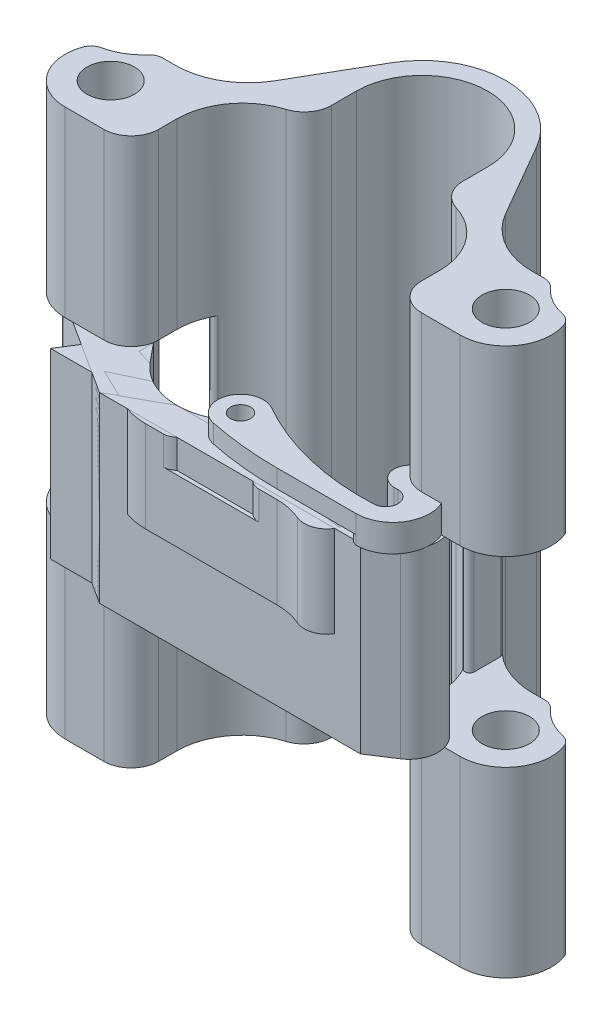
from build123d import *

# Parameters (mm, degrees)
SKETCH19_R              = 3.302
SKETCH19_R_2            = 1.5875
BOSS_EXTRUDE4_DEPTH     = 12.7
CUT_EXTRUDE2_START      = 12.7
CUT_EXTRUDE2_DEPTH      = 4
BOSS_EXTRUDE5_START     = 13.97
SKETCH20_R              = 1.4
BOSS_EXTRUDE5_DEPTH     = 2.54
BOSS_EXTRUDE6_REACH     = 49.508
FILLET3_R               = 1.905
SKETCH9_R               = 3.302
BOSS_EXTRUDE1_DEPTH     = 76.2
FILLET2_R               = 1.905
CUT_EXTRUDE1_DEPTH      = 95.251173486
CUT_EXTRUDE1_DEPTH_BACK = 95.251173486
SKETCH11_W              = 23.485343907
SKETCH11_H              = 25.4
FILLET1_START           = 31.75
FILLET1_DEPTH           = 25.4
SKETCH16_R              = 3.302
BOSS_EXTRUDE2_DEPTH     = 25.4
BOSS_EXTRUDE3_DEPTH     = 25.4


with BuildPart() as part:
    # Sketch19 → Boss-Extrude4 (new body)
    with BuildSketch(Plane(origin=(0, 44.45, 0), x_dir=(1, 0, 0), z_dir=(0, 1, 0))):
        with BuildLine():
            Line((-29.706388395, -20.449050539), (-13.016758738, -28.513116917))
            ThreePointArc((-13.016758738, -28.513116917), (-11.130472315, -29.175223594), (-9.144, -29.399699566))
            Line((-9.144, -29.399699566), (9.144, -29.399699566))
            ThreePointArc((9.144, -29.399699566), (10.971992807, -29.584281153), (12.726185567, -30.130573954))
            ThreePointArc((12.726185567, -30.130573954), (17.145, -27.209349783), (12.726185567, -24.288125612))
            ThreePointArc((12.726185567, -24.288125612), (6.281816233, -24.559505748), (1.261595802, -20.509699566))
            Line((1.261595802, -20.509699566), (-1.261595802, -20.509699566))
            ThreePointArc((-1.261595802, -20.509699566), (-8.447611674, -24.992443682), (-16.231079518, -21.653065412))
            Line((-16.231079518, -21.653065412), (-23.559040171, -12.66496366))
            ThreePointArc((-23.559040171, -12.66496366), (-31.483008687, -12.726570832), (-29.706388395, -20.449050539))
        make_face()
        with Locations(Location((-27.49630657, -15.875, 0), (0, 0, 270))):
            Circle(SKETCH19_R, mode=Mode.SUBTRACT)
        with Locations(Location((13.97, -27.209349783, 0), (0, 0, 270))):
            Circle(SKETCH19_R_2, mode=Mode.SUBTRACT)
    extrude(amount=BOSS_EXTRUDE4_DEPTH)

    # Sketch19<3> → Cut-Extrude2 (cut)
    with BuildSketch(Plane(origin=(0, 44.45, 0), x_dir=(1, 0, 0), z_dir=(0, 1, 0)).offset(CUT_EXTRUDE2_START)):
        with BuildLine():
            Line((-2.38156986, -23.929349783), (-5.53987778, -29.399699566))
            Line((-5.53987778, -29.399699566), (5.53987778, -29.399699566))
            Line((5.53987778, -29.399699566), (2.38156986, -23.929349783))
            ThreePointArc((2.38156986, -23.929349783), (0, -22.554349783), (-2.38156986, -23.929349783))
        make_face()
    extrude(amount=-CUT_EXTRUDE2_DEPTH, mode=Mode.SUBTRACT)

    # Fillet3
    fillet3_edges = [part.edges().sort_by_distance(p)[0] for p in [
        (-1.261595802, 50.8, 20.509699566),
        (1.261595802, 50.8, 20.509699566),
        (5.53987778, 55.15, 29.399699566),
        (-5.53987778, 55.15, 29.399699566),
    ]]
    fillet(fillet3_edges, radius=FILLET3_R)



with BuildPart() as body_2:
    # Sketch20 → Boss-Extrude5 (new body)
    # profile 1 of 2: a face of its own
    with BuildSketch(Plane(origin=(0, 44.45, 0), x_dir=(1, 0, 0), z_dir=(0, 1, 0)).offset(BOSS_EXTRUDE5_START)):
        with BuildLine():
            ThreePointArc((20.278092312, -27.016736874), (19.141646765, -28.169156581), (20.193, -29.399699566))
            Line((20.193, -29.399699566), (9.144, -29.399699566))
            ThreePointArc((9.144, -29.399699566), (4.230940498, -29.153071232), (-0.632721967, -28.415665889))
            ThreePointArc((-0.632721967, -28.415665889), (-2.971799298, -24.186747917), (1.574258141, -22.547116332))
            ThreePointArc((1.574258141, -22.547116332), (10.60643046, -26.119949156), (20.278092312, -27.016736874))
        make_face()
        with Locations(Location((0, -25.304349783, 0), (0, 0, 270))):
            Circle(SKETCH20_R, mode=Mode.SUBTRACT)
    # profile 2 of 2: a face of its own
    with BuildSketch(Plane(origin=(0, 44.45, 0), x_dir=(1, 0, 0), z_dir=(0, 1, 0)).offset(BOSS_EXTRUDE5_START)):
        with BuildLine():
            ThreePointArc((20.193, -23.589849783), (21.906971691, -25.261790512), (20.278092312, -27.016736874))
            ThreePointArc((20.278092312, -27.016736874), (19.141646765, -28.169156581), (20.193, -29.399699566))
            ThreePointArc((20.193, -29.399699566), (25.320424891, -24.272274674), (20.193, -19.144849783))
            Line((20.193, -19.144849783), (19.685, -19.144849783))
            ThreePointArc((19.685, -19.144849783), (17.4625, -21.367349783), (19.685, -23.589849783))
            Line((19.685, -23.589849783), (20.193, -23.589849783))
        make_face()
    extrude(amount=BOSS_EXTRUDE5_DEPTH)

    # Sketch20<3> → Boss-Extrude6 (add, up to next)
    with BuildSketch(Plane(origin=(0, 44.45, 0), x_dir=(1, 0, 0), z_dir=(0, 1, 0)), mode=Mode.PRIVATE) as boss_extrude6_sk1:
        with BuildLine():
            ThreePointArc((20.193, -23.589849783), (21.906971691, -25.261790512), (20.278092312, -27.016736874))
            ThreePointArc((20.278092312, -27.016736874), (19.141646765, -28.169156581), (20.193, -29.399699566))
            ThreePointArc((20.193, -29.399699566), (25.320424891, -24.272274674), (20.193, -19.144849783))
            Line((20.193, -19.144849783), (19.685, -19.144849783))
            ThreePointArc((19.685, -19.144849783), (17.4625, -21.367349783), (19.685, -23.589849783))
            Line((19.685, -23.589849783), (20.193, -23.589849783))
        make_face()
    boss_extrude6_tool1 = extrude(boss_extrude6_sk1.sketch, amount=BOSS_EXTRUDE6_REACH, mode=Mode.PRIVATE) - body_2.part
    add(boss_extrude6_tool1.solids().sort_by_distance((21.712164, 44.45, 23.729838))[0])


with BuildPart() as part_1:
    add(part.part)

    add(body_2.part)  # Boss-Extrude1 merges body 2
    # Sketch9 → Boss-Extrude1 (add)
    with BuildSketch(Plane(origin=(0, 6.35, 0), x_dir=(1, 0, 0), z_dir=(0, 1, 0))):
        with BuildLine():
            Line((-9.144, -0.037127416), (-9.144, -3.493965471))
            ThreePointArc((-9.144, -3.493965471), (-9.88923727, -5.757442755), (-11.833411765, -7.135446215))
            ThreePointArc((-11.833411765, -7.135446215), (-16.499430551, -10.44265452), (-18.288, -15.875))
            Line((-18.288, -15.875), (-18.288, -18.415))
            ThreePointArc((-18.288, -18.415), (-19.403923164, -21.109076836), (-22.098, -22.225))
            Line((-22.098, -22.225), (-27.49630657, -22.225))
            ThreePointArc((-27.49630657, -22.225), (-32.995567884, -19.05), (-32.995567884, -12.7))
            ThreePointArc((-32.995567884, -12.7), (-29.899453324, -11.712627725), (-27.49630657, -9.525))
            Line((-27.49630657, -9.525), (-24.835225616, -9.525))
            ThreePointArc((-24.835225616, -9.525), (-19.755225616, -8.163818102), (-16.036407514, -4.445))
            Line((-16.036407514, -4.445), (-10.118640818, 5.804872584))
            ThreePointArc((-10.118640818, 5.804872584), (0, 11.646872584), (10.118640818, 5.804872584))
            Line((10.118640818, 5.804872584), (16.036407514, -4.445))
            ThreePointArc((16.036407514, -4.445), (19.755225616, -8.163818102), (24.835225616, -9.525))
            Line((24.835225616, -9.525), (27.49630657, -9.525))
            ThreePointArc((27.49630657, -9.525), (29.899453324, -11.712627725), (32.995567884, -12.7))
            ThreePointArc((32.995567884, -12.7), (32.995567884, -19.05), (27.49630657, -22.225))
            Line((27.49630657, -22.225), (22.098, -22.225))
            ThreePointArc((22.098, -22.225), (19.403923164, -21.109076836), (18.288, -18.415))
            Line((18.288, -18.415), (18.288, -15.875))
            ThreePointArc((18.288, -15.875), (16.499430551, -10.44265452), (11.833411765, -7.135446215))
            ThreePointArc((11.833411765, -7.135446215), (9.88923727, -5.757442755), (9.144, -3.493965471))
            Line((9.144, -3.493965471), (9.144, -0.037127416))
            ThreePointArc((9.144, -0.037127416), (0, 9.106872584), (-9.144, -0.037127416))
        make_face()
        with Locations(Location((27.49630657, -15.875, 0), (0, 0, 270))):
            Circle(SKETCH9_R, mode=Mode.SUBTRACT)
        with Locations(Location((-27.49630657, -15.875, 0), (0, 0, 270))):
            Circle(SKETCH9_R, mode=Mode.SUBTRACT)
    extrude(amount=BOSS_EXTRUDE1_DEPTH)

    # Fillet2
    fillet2_edges = [part_1.edges().sort_by_distance(p)[0] for p in [
        (-32.995567884, 44.45, 12.7),
        (-27.49630657, 44.45, 9.525),
        (27.49630657, 44.45, 9.525),
        (32.995567884, 44.45, 12.7),
    ]]
    fillet(fillet2_edges, radius=FILLET2_R)

    # Sketch11 → Cut-Extrude1 (cut, two sides: drawn at the far end of the back side and taken through both)
    with BuildSketch(Plane.XY.offset(-CUT_EXTRUDE1_DEPTH_BACK)):
        with Locations((-30.030671954, 44.45)):
            Rectangle(SKETCH11_W, SKETCH11_H)
        with Locations((30.030671954, 44.45)):
            Rectangle(SKETCH11_W, SKETCH11_H)
    extrude(amount=CUT_EXTRUDE1_DEPTH + CUT_EXTRUDE1_DEPTH_BACK, mode=Mode.SUBTRACT)


with BuildPart() as cut_extrude1_piece_1:
    # of the separate pieces the step leaves, piece 1, a body of its own (cut_extrude1_pieces)
    add(part_1.part.solids().sort_by_distance((-33.498274605, 6.35, 13.801626009))[0])

    # Fillet1: read off the stored shape, not the designer's step
    # Fillet1 outline → Fillet1 (cut)
    with BuildSketch(Plane(origin=(0, 0, 0), x_dir=(1, 0, 0), z_dir=(0, 1, 0)).offset(FILLET1_START)):
        with BuildLine():
            Line((-18.288, -7.134133589), (-18.288, -7.424011118))
            ThreePointArc((-18.288, -7.424011118), (-18.232440355, -7.16425378), (-18.07548386, -6.94995164))
            ThreePointArc((-18.07548386, -6.94995164), (-18.181104644, -7.042777939), (-18.288, -7.134133589))
        make_face()
        with BuildLine():
            ThreePointArc((-17.100467532, -11.368631129), (-17.814812983, -11.669725944), (-18.288, -11.055688846))
            Line((-18.288, -11.055688846), (-18.288, -15.875))
            ThreePointArc((-18.288, -15.875), (-17.98613422, -13.544893041), (-17.100467532, -11.368631129))
        make_face()
        with BuildLine():
            ThreePointArc((18.288, -7.134133589), (18.181104644, -7.042777939), (18.07548386, -6.94995164))
            ThreePointArc((18.07548386, -6.94995164), (18.232440355, -7.16425378), (18.288, -7.424011118))
            Line((18.288, -7.424011118), (18.288, -7.134133589))
        make_face()
        with BuildLine():
            Line((18.288, -15.875), (18.288, -11.055688846))
            ThreePointArc((18.288, -11.055688846), (17.814812983, -11.669725944), (17.100467532, -11.368631129))
            ThreePointArc((17.100467532, -11.368631129), (17.98613422, -13.544893041), (18.288, -15.875))
        make_face()
    extrude(amount=FILLET1_DEPTH, mode=Mode.SUBTRACT)


with BuildPart() as cut_extrude1_piece_2:
    # of the separate pieces the step leaves, piece 2, a body of its own (cut_extrude1_pieces)
    add(part_1.part.solids().sort_by_distance((-18.288, 44.45, 25.966167685))[0])


with BuildPart() as body_3:
    # Sketch16 → Boss-Extrude2 (new body)
    # profile 1 of 2: a face of its own
    with BuildSketch(Plane(origin=(0, 31.75, 0), x_dir=(1, 0, 0), z_dir=(0, 1, 0))):
        with BuildLine():
            ThreePointArc((-22.098, -22.225), (-19.689367279, -21.367048173), (-18.365506655, -19.179587096))
            Line((-18.365506655, -19.179587096), (-23.887511894, -12.767266544))
            ThreePointArc((-23.887511894, -12.767266544), (-31.092116784, -12.752251986), (-30.067684815, -19.883668129))
            Line((-30.067684815, -19.883668129), (-26.417649093, -22.225))
            Line((-26.417649093, -22.225), (-22.098, -22.225))
        make_face()
        with Locations(Location((-27.49630657, -15.875, 0), (0, 0, 180))):
            Circle(SKETCH16_R, mode=Mode.SUBTRACT)
    # profile 2 of 2: a face of its own
    with BuildSketch(Plane(origin=(0, 31.75, 0), x_dir=(1, 0, 0), z_dir=(0, 1, 0))):
        with BuildLine():
            ThreePointArc((-2.689411765, -22.351961225), (-9.492271956, -25.012365192), (-16.072885779, -21.841848236))
            Line((-16.072885779, -21.841848236), (-18.365506655, -19.179587096))
            ThreePointArc((-18.365506655, -19.179587096), (-19.689367279, -21.367048173), (-22.098, -22.225))
            Line((-22.098, -22.225), (-26.417649093, -22.225))
            Line((-26.417649093, -22.225), (-16.072885779, -28.860695069))
            Line((-16.072885779, -28.860695069), (0, -28.860695069))
            ThreePointArc((0, -28.860695069), (3.521240971, -23.595716709), (-2.689411765, -22.351961225))
        make_face()
    extrude(amount=BOSS_EXTRUDE2_DEPTH)


with BuildPart() as body_4:
    # Sketch17 → Boss-Extrude3 (new body)
    with BuildSketch(Plane(origin=(0, 31.75, 0), x_dir=(1, 0, 0), z_dir=(0, 1, 0))):
        with BuildLine():
            Line((-19.061950135, -26.943346261), (-16.072885779, -28.860695069))
            Line((-16.072885779, -28.860695069), (16.072885779, -28.860695069))
            Line((16.072885779, -28.860695069), (20.253155768, -28.860695069))
            Line((20.253155768, -28.860695069), (23.642542472, -26.659601607))
            ThreePointArc((23.642542472, -26.659601607), (25.299472362, -22.168296614), (21.463714012, -19.304))
            Line((21.463714012, -19.304), (19.685714012, -19.304))
            ThreePointArc((19.685714012, -19.304), (18.542714012, -20.447), (19.685714012, -21.59))
            Line((19.685714012, -21.59), (20.193714012, -21.59))
            ThreePointArc((20.193714012, -21.59), (21.908214012, -23.3045), (20.193714012, -25.019))
            Line((20.193714012, -25.019), (9.144, -25.019))
            Line((9.144, -25.019), (-9.144, -25.019))
            ThreePointArc((-9.144, -25.019), (-12.95529084, -24.186846855), (-16.072885779, -21.841848236))
            Line((-16.072885779, -21.841848236), (-18.512428595, -19.008976867))
            ThreePointArc((-18.512428595, -19.008976867), (-23.900496356, -18.997748014), (-23.134360122, -24.331080514))
            Line((-23.134360122, -24.331080514), (-24.810009763, -26.943346261))
            Line((-24.810009763, -26.943346261), (-19.061950135, -26.943346261))
        make_face()
    extrude(amount=BOSS_EXTRUDE3_DEPTH)


solid = Compound([cut_extrude1_piece_1.part, cut_extrude1_piece_2.part, body_3.part, body_4.part])
